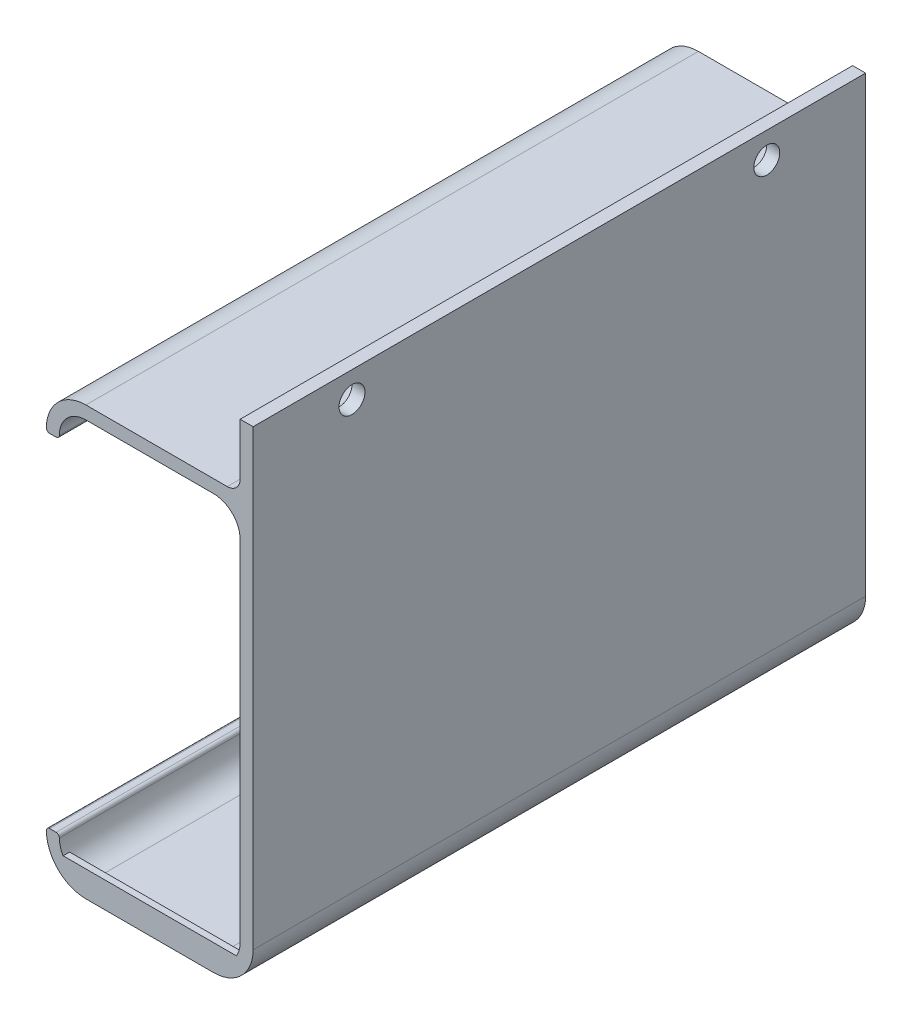
from build123d import *

# Parameters (mm, degrees)
BOSS_EXTRUDE1_DEPTH = 46.25
FILLET1_R           = 0.5
BOSS_EXTRUDE2_START = 1
BOSS_EXTRUDE2_DEPTH = 1
SKETCH3_R           = 2
CUT_EXTRUDE1_DEPTH  = 21


with BuildPart() as part:
    # Sketch1 → Boss-Extrude1 (new, symmetric)
    with BuildSketch(Plane(origin=(0, 0, 0), x_dir=(0, 1, 0), z_dir=(0, 0, 1))):
        with BuildLine():
            Line((-26.9, 13.95), (-26.4, 13.95))
            Line((-26.4, 13.95), (-26.4, 15.95))
            Line((-26.4, 15.95), (-26.9, 15.95))
            ThreePointArc((-26.9, 15.95), (-31.213351365, 14.163351365), (-33, 9.85))
            Line((-33, 9.85), (-33, -9.85))
            ThreePointArc((-33, -9.85), (-31.213351365, -14.163351365), (-26.9, -15.95))
            Line((-26.9, -15.95), (26.9, -15.95))
            Line((26.9, -15.95), (43, -15.95))
            Line((43, -15.95), (43, -13.95))
            Line((43, -13.95), (35, -13.95))
            ThreePointArc((35, -13.95), (33.585786438, -13.364213562), (33, -11.95))
            Line((33, -11.95), (33, -9.85))
            Line((33, -9.85), (33, 9.85))
            ThreePointArc((33, 9.85), (31.213351365, 14.163351365), (26.9, 15.95))
            Line((26.9, 15.95), (26.4, 15.95))
            Line((26.4, 15.95), (26.4, 13.95))
            Line((26.4, 13.95), (26.9, 13.95))
            ThreePointArc((26.9, 13.95), (29.799137803, 12.749137803), (31, 9.85))
            Line((31, 9.85), (31, -9.85))
            ThreePointArc((31, -9.85), (29.799137803, -12.749137803), (26.9, -13.95))
            Line((26.9, -13.95), (-26.9, -13.95))
            ThreePointArc((-26.9, -13.95), (-29.799137803, -12.749137803), (-31, -9.85))
            Line((-31, -9.85), (-31, 9.85))
            ThreePointArc((-31, 9.85), (-29.799137803, 12.749137803), (-26.9, 13.95))
        make_face()
    extrude(amount=BOSS_EXTRUDE1_DEPTH, both=True)

    # Fillet1
    fillet1_edges = [part.edges().sort_by_distance(p)[0] for p in [
        (-15.95, 26.4, 0),
        (-13.95, 26.4, 0),
        (-13.95, -26.4, 0),
        (-15.95, -26.4, 0),
    ]]
    fillet(fillet1_edges, radius=FILLET1_R - 0.0001)  # a hair under: the kernel refuses the full size

    # Sketch2 → Boss-Extrude2 (add)
    with BuildSketch(Plane.XY.offset(46.25).offset(BOSS_EXTRUDE2_START)):
        with BuildLine():
            Line((-13.371363372, -29), (13.371363372, -29))
            ThreePointArc((13.371363372, -29), (13.80269464, -27.989130427), (13.95, -26.9))
            Line((13.95, -26.9), (13.95, 26.9))
            ThreePointArc((13.95, 26.9), (12.749137803, 29.799137803), (9.85, 31))
            Line((9.85, 31), (-9.85, 31))
            ThreePointArc((-9.85, 31), (-12.749137803, 29.799137803), (-13.95, 26.9))
            ThreePointArc((-13.95, 26.9), (-14.096446609, 26.546446609), (-14.45, 26.4))
            Line((-14.45, 26.4), (-15.45, 26.4))
            ThreePointArc((-15.45, 26.4), (-15.803553391, 26.546446609), (-15.95, 26.9))
            ThreePointArc((-15.95, 26.9), (-14.163351365, 31.213351365), (-9.85, 33))
            Line((-9.85, 33), (11.95, 33))
            ThreePointArc((11.95, 33), (13.364213562, 33.585786438), (13.95, 35))
            Line((13.95, 35), (13.95, 43))
            Line((13.95, 43), (15.95, 43))
            Line((15.95, 43), (15.95, -26.9))
            ThreePointArc((15.95, -26.9), (14.163351365, -31.213351365), (9.85, -33))
            Line((9.85, -33), (-9.85, -33))
            ThreePointArc((-9.85, -33), (-14.163351365, -31.213351365), (-15.95, -26.9))
            ThreePointArc((-15.95, -26.9), (-15.803553391, -26.546446609), (-15.45, -26.4))
            Line((-15.45, -26.4), (-14.45, -26.4))
            ThreePointArc((-14.45, -26.4), (-14.096446609, -26.546446609), (-13.95, -26.9))
            ThreePointArc((-13.95, -26.9), (-13.80269464, -27.989130427), (-13.371363372, -29))
        make_face()
    boss_extrude2 = extrude(amount=-BOSS_EXTRUDE2_DEPTH)

    # Mirror1: Boss-Extrude2 across plane
    add(boss_extrude2.mirror(Plane.XY))

    # Sketch3 → Cut-Extrude1 (cut)
    with BuildSketch(Plane(origin=(13.95, 0, 0), x_dir=(0, -1, 0), z_dir=(-1, 0, 0))):
        with Locations(Location((-39, 32, 0), (0, 0, 90))):
            Circle(SKETCH3_R)
        with Locations(Location((-39, -32, 0), (0, 0, 90))):
            Circle(SKETCH3_R)
    extrude(amount=-CUT_EXTRUDE1_DEPTH, mode=Mode.SUBTRACT)


solid = part.part
